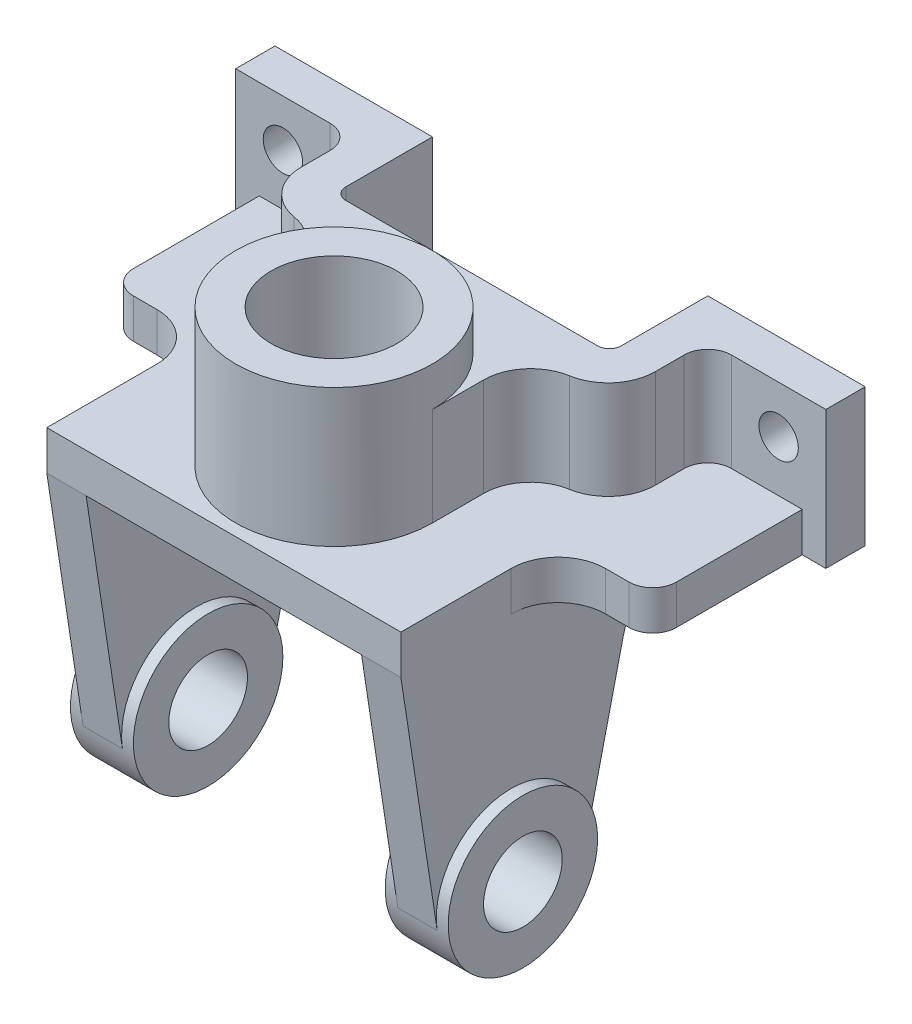
from build123d import *

# Parameters (mm, degrees)
BOSS_EXTRUDE1_DEPTH   = 10
SKETCH1_3_R           = 25
SKETCH1_3_R_2         = 16
BOSS_EXTRUDE2_DEPTH   = 45
BOSS_EXTRUDE3_DEPTH   = 35
FILLET1_R             = 12
BOSS_EXTRUDE4_DEPTH   = 10
BOSS_EXTRUDE5_START   = 3
SKETCH2_3_R           = 19
SKETCH2_3_R_2         = 10
BOSS_EXTRUDE5_DEPTH   = 16
FILLET2_R             = 25
MIRROR1_START         = -45
MIRROR1_OUTLINE_R     = 10
MIRROR1_DEPTH         = 10
MIRROR1_START_2       = -48
MIRROR1_2_OUTLINE_R   = 19
MIRROR1_2_OUTLINE_R_2 = 10
MIRROR1_2_DEPTH       = 16
SKETCH3_R             = 5
CUT_EXTRUDE1_DEPTH    = 133.483106346


# Read off the part's stored shape, not the designer's step: Mirror1
with BuildPart() as part:
    # Sketch1 → Boss-Extrude1 (new body)
    with BuildSketch(Plane(origin=(0, 0, 0), x_dir=(1, 0, 0), z_dir=(0, 1, 0))):
        with BuildLine():
            Line((-51, 50), (-69, 50))
            Line((-69, 50), (-69, 18))
            ThreePointArc((-69, 18), (-67.242640687, 13.757359313), (-63, 12))
            Line((-63, 12), (-57, 12))
            ThreePointArc((-57, 12), (-48.514718626, 8.485281374), (-45, 0))
            Line((-45, 0), (-45, -28))
            Line((-45, -28), (45, -28))
            Line((45, -28), (45, 0))
            ThreePointArc((45, 0), (48.514718626, 8.485281374), (57, 12))
            Line((57, 12), (63, 12))
            ThreePointArc((63, 12), (67.242640687, 13.757359313), (69, 18))
            Line((69, 18), (69, 50))
            Line((69, 50), (51, 50))
            ThreePointArc((51, 50), (46.757359313, 48.242640687), (45, 44))
            Line((45, 44), (45, 25))
            Line((45, 25), (37, 25))
            ThreePointArc((37, 25), (28.514718626, 21.485281374), (25, 13))
            Line((25, 13), (25, 0))
            ThreePointArc((25, 0), (0, -25), (-25, 0))
            Line((-25, 0), (-25, 13))
            ThreePointArc((-25, 13), (-28.514718626, 21.485281374), (-37, 25))
            Line((-37, 25), (-45, 25))
            Line((-45, 25), (-45, 44))
            ThreePointArc((-45, 44), (-46.757359313, 48.242640687), (-51, 50))
        make_face()
    extrude(amount=BOSS_EXTRUDE1_DEPTH)

    # Sketch1<3> → Boss-Extrude2 (add)
    with BuildSketch(Plane(origin=(0, 0, 0), x_dir=(1, 0, 0), z_dir=(0, 1, 0))):
        Circle(SKETCH1_3_R)
        with Locations(Location((0, 0, 0), (0, 0, 90))):
            Circle(SKETCH1_3_R_2, mode=Mode.SUBTRACT)
    extrude(amount=BOSS_EXTRUDE2_DEPTH)

    # Sketch1<4> → Boss-Extrude3 (add)
    with BuildSketch(Plane(origin=(0, 0, 0), x_dir=(1, 0, 0), z_dir=(0, 1, 0))):
        with BuildLine():
            Line((32, 35), (-32, 35))
            ThreePointArc((-32, 35), (-34.121320344, 35.878679656), (-35, 38))
            Line((-35, 38), (-35, 60))
            Line((-35, 60), (-75, 60))
            Line((-75, 60), (-75, 50))
            Line((-75, 50), (-69, 50))
            Line((-69, 50), (-51, 50))
            ThreePointArc((-51, 50), (-46.757359313, 48.242640687), (-45, 44))
            Line((-45, 44), (-45, 25))
            Line((-45, 25), (-37, 25))
            ThreePointArc((-37, 25), (-28.514718626, 21.485281374), (-25, 13))
            Line((-25, 13), (-25, 0))
            ThreePointArc((-25, 0), (0, 25), (25, 0))
            Line((25, 0), (25, 13))
            ThreePointArc((25, 13), (28.514718626, 21.485281374), (37, 25))
            Line((37, 25), (45, 25))
            Line((45, 25), (45, 44))
            ThreePointArc((45, 44), (46.757359313, 48.242640687), (51, 50))
            Line((51, 50), (69, 50))
            Line((69, 50), (75, 50))
            Line((75, 50), (75, 60))
            Line((75, 60), (35, 60))
            Line((35, 60), (35, 38))
            ThreePointArc((35, 38), (34.121320344, 35.878679656), (32, 35))
        make_face()
    extrude(amount=BOSS_EXTRUDE3_DEPTH)

    # Fillet1
    fillet1_edges = [part.edges().sort_by_distance(p)[0] for p in [
        (-45, 22.5, -25),
        (45, 22.5, -25),
    ]]
    fillet(fillet1_edges, radius=FILLET1_R)

    # Sketch2 → Boss-Extrude4 (add)
    with BuildSketch(Plane(origin=(45, 0, 0), x_dir=(0, 0, -1), z_dir=(1, 0, 0))):
        with BuildLine():
            Line((0, 0), (-28, 0))
            Line((-28, 0), (-18.781868567, -60.308822731))
            ThreePointArc((-18.781868567, -60.308822731), (-14.414314705, -45.059525702), (0, -38.438036581))
            Line((0, -38.438036581), (0, 0))
        make_face()
        with BuildLine():
            Line((33, 0), (0, 0))
            Line((0, 0), (0, -38.438036581))
            ThreePointArc((0, -38.438036581), (13.435028843, -44.003007739), (19, -57.438036581))
            ThreePointArc((19, -57.438036581), (18.873874635, -59.623638617), (18.497173025, -61.780223826))
            Line((18.497173025, -61.780223826), (33, 0))
        make_face()
    extrude(amount=-BOSS_EXTRUDE4_DEPTH)

    # Sketch2<3> → Boss-Extrude5 (add)
    with BuildSketch(Plane(origin=(45, 0, 0), x_dir=(0, 0, -1), z_dir=(1, 0, 0)).offset(BOSS_EXTRUDE5_START)):
        with Locations((0, -57.438036581)):
            Circle(SKETCH2_3_R)
        with Locations((0, -57.438036581)):
            Circle(SKETCH2_3_R_2, mode=Mode.SUBTRACT)
    extrude(amount=-BOSS_EXTRUDE5_DEPTH)

    # Fillet2
    # the kernel refuses this fillet: 25 mm, written as the material it adds along each edge
    with BuildSketch(Plane(origin=(45, 0, -33), x_dir=(0, 0, -1), z_dir=(-1, 0, 0))) as fillet2_piece_1:
        with BuildLine():
            CenterArc((FILLET2_R * 0.792435294557, FILLET2_R), FILLET2_R, 193.210905315, 76.789094685)
            Line((-FILLET2_R * 0.181100127826, FILLET2_R * 0.771463829198), (0, 0))
            Line((0, 0), (FILLET2_R * 0.792435294557, 0))
        make_face()
    extrude(amount=10)

    # Mirror1 outline → Mirror1 (add)
    with BuildSketch(Plane.YZ.offset(MIRROR1_START)):
        with BuildLine():
            Line((0, 28), (-60.308822731, 18.781868567))
            ThreePointArc((-60.308822731, 18.781868567), (-76.423254036, 0.74934517), (-61.780223826, -18.497173025))
            Line((-61.780223826, -18.497173025), (-19.28659573, -28.472496804))
            ThreePointArc((-19.28659573, -28.472496804), (-5.406185839, -37.284052468), (0, -52.810882364))
            Line((0, -52.810882364), (0, 28))
        make_face()
        with Locations((-57.438036581, 0)):
            Circle(MIRROR1_OUTLINE_R, mode=Mode.SUBTRACT)
    extrude(amount=MIRROR1_DEPTH)

    # Mirror1 2 outline → Mirror1 2 (add)
    with BuildSketch(Plane.YZ.offset(MIRROR1_START_2)):
        with Locations((-57.438036581, 0)):
            Circle(MIRROR1_2_OUTLINE_R)
        with Locations((-57.438036581, 0)):
            Circle(MIRROR1_2_OUTLINE_R_2, mode=Mode.SUBTRACT)
    extrude(amount=MIRROR1_2_DEPTH)

    # Sketch3 → Cut-Extrude1 (cut, through all)
    with BuildSketch(Plane.XY.offset(-50)):
        with Locations((63, 23)):
            Circle(SKETCH3_R)
    cut_extrude1 = extrude(amount=-CUT_EXTRUDE1_DEPTH, mode=Mode.SUBTRACT)

    # Mirror2: Cut-Extrude1 across plane
    add(cut_extrude1.mirror(Plane(origin=(0, 0, 0), x_dir=(0, 0, 1), z_dir=(1, 0, 0))), mode=Mode.SUBTRACT)


solid = part.part
